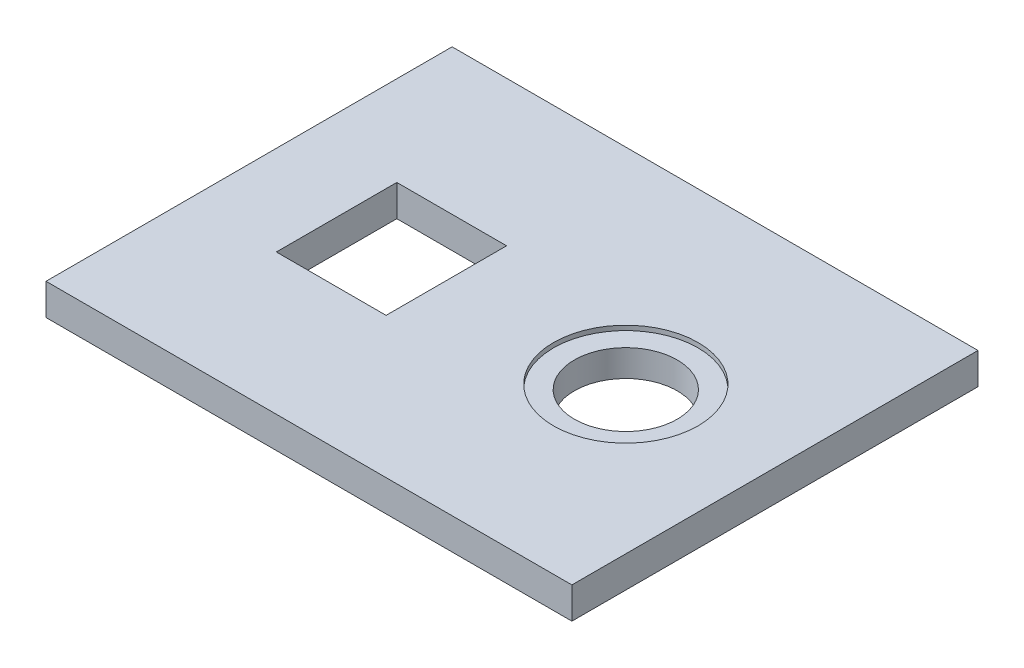
from build123d import *

# Parameters (mm, degrees)
SKETCH2_W               = 196.45
SKETCH2_H               = 151.7
BOSS_EXTRUDE1_DEPTH     = 11.74
CUT_EXTRUDE2_DEPTH      = 15
CUT_EXTRUDE2_DEPTH_BACK = 22
SKETCH3_R               = 19.2
SKETCH3_W               = 41
SKETCH3_H               = 45
SKETCH4_R               = 26.99
CUT_EXTRUDE3_DEPTH      = 1.74


with BuildPart() as part:
    # Sketch2 → Boss-Extrude1 (new body)
    with BuildSketch(Plane(origin=(0, 0, 0), x_dir=(1, 0, 0), z_dir=(0, 1, 0))):
        with Locations((-1.775, 0.85)):
            Rectangle(SKETCH2_W, SKETCH2_H)
    extrude(amount=BOSS_EXTRUDE1_DEPTH)

    # Sketch3 → Cut-Extrude2 (cut, two sides: drawn at the far end of the back side and taken through both)
    with BuildSketch(Plane(origin=(0, 0, 0), x_dir=(1, 0, 0), z_dir=(0, 1, 0)).offset(-CUT_EXTRUDE2_DEPTH_BACK)):
        with Locations((41.585, 0)):
            Circle(SKETCH3_R)
        with Locations((-45.952707493, 0)):
            Rectangle(SKETCH3_W, SKETCH3_H)
    extrude(amount=CUT_EXTRUDE2_DEPTH + CUT_EXTRUDE2_DEPTH_BACK, mode=Mode.SUBTRACT)

    # Sketch4 → Cut-Extrude3 (cut)
    with BuildSketch(Plane(origin=(0, 11.74, 0), x_dir=(1, 0, 0), z_dir=(0, 1, 0))):
        with Locations((41.585, 0)):
            Circle(SKETCH4_R)
    extrude(amount=-CUT_EXTRUDE3_DEPTH, mode=Mode.SUBTRACT)


solid = part.part
